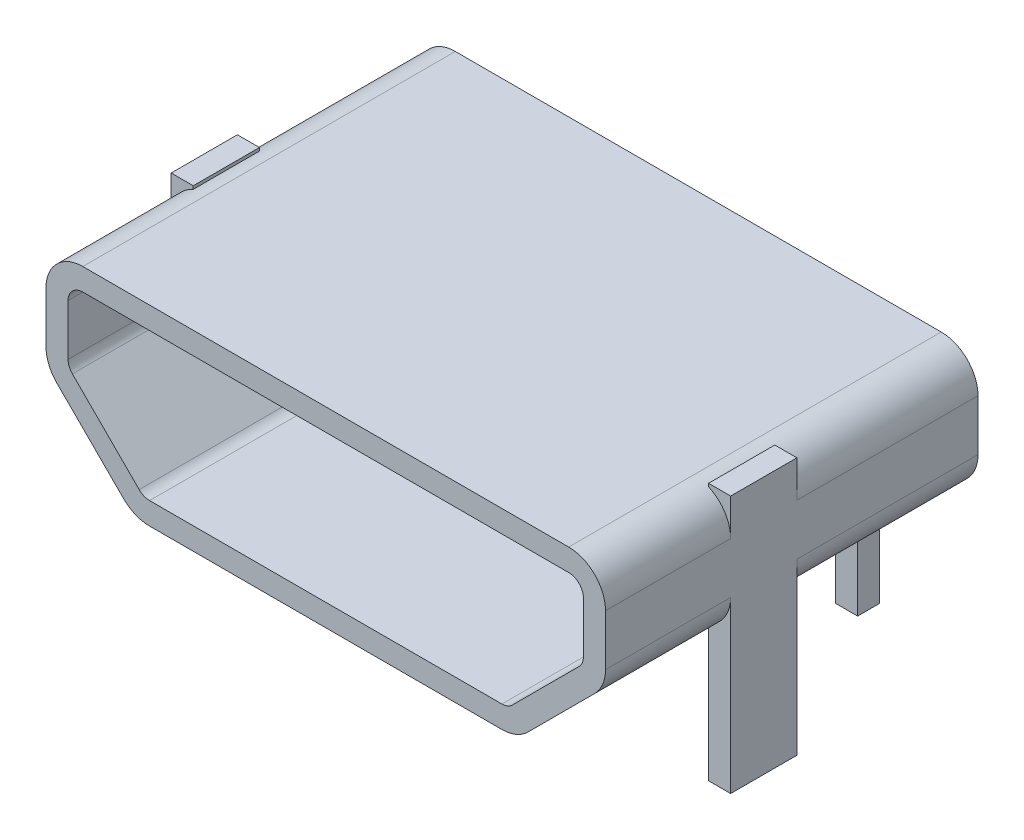
from build123d import *

# Parameters (mm, degrees)
EXTRUDE_1_DEPTH     = 5.06
CUT_EXTRUDE_1_REACH = 8.841
SKETCH_2_W          = 0.3
SKETCH_2_H          = 0.3
SKETCH_2_H_2        = 0.9
EXTRUDE_2_DEPTH     = 3.5


with BuildPart() as part:
    # 草图1 → 凸台-拉伸1 (new body)
    with BuildSketch(Plane.XY):
        with BuildLine():
            Line((-3.653553391, 1.053553391), (-2.746446609, 0.146446609))
            ThreePointArc((-2.746446609, 0.146446609), (-2.584234935, 0.038060234), (-2.392893219, 0))
            Line((-2.392893219, 0), (2.392893219, 0))
            ThreePointArc((2.392893219, 0), (2.584234935, 0.038060234), (2.746446609, 0.146446609))
            Line((2.746446609, 0.146446609), (3.653553391, 1.053553391))
            ThreePointArc((3.653553391, 1.053553391), (3.761939766, 1.215765065), (3.8, 1.407106781))
            Line((3.8, 1.407106781), (3.8, 2.1))
            ThreePointArc((3.8, 2.1), (3.653553391, 2.453553391), (3.3, 2.6))
            Line((3.3, 2.6), (-3.3, 2.6))
            ThreePointArc((-3.3, 2.6), (-3.653553391, 2.453553391), (-3.8, 2.1))
            Line((-3.8, 2.1), (-3.8, 1.407106781))
            ThreePointArc((-3.8, 1.407106781), (-3.761939766, 1.215765065), (-3.653553391, 1.053553391))
        make_face()
    extrude(amount=EXTRUDE_1_DEPTH)

    # 草图4 → 切除-拉伸1 (cut, up to next)
    with BuildSketch(Plane(origin=(0, 0, 0), x_dir=(-1, 0, 0), z_dir=(0, 0, -1)), mode=Mode.PRIVATE) as cut_extrude_1_sk1:
        with BuildLine():
            Line((-2.392893219, 0.3), (2.392893219, 0.3))
            ThreePointArc((2.392893219, 0.3), (2.469429905, 0.315224093), (2.534314575, 0.358578644))
            Line((2.534314575, 0.358578644), (3.441421356, 1.265685425))
            ThreePointArc((3.441421356, 1.265685425), (3.484775907, 1.330570095), (3.5, 1.407106781))
            Line((3.5, 1.407106781), (3.5, 2.1))
            ThreePointArc((3.5, 2.1), (3.441421356, 2.241421356), (3.3, 2.3))
            Line((3.3, 2.3), (-3.3, 2.3))
            ThreePointArc((-3.3, 2.3), (-3.441421356, 2.241421356), (-3.5, 2.1))
            Line((-3.5, 2.1), (-3.5, 1.407106781))
            ThreePointArc((-3.5, 1.407106781), (-3.484775907, 1.330570095), (-3.441421356, 1.265685425))
            Line((-3.441421356, 1.265685425), (-2.534314575, 0.358578644))
            ThreePointArc((-2.534314575, 0.358578644), (-2.469429905, 0.315224093), (-2.392893219, 0.3))
        make_face()
    cut_extrude_1_tool1 = extrude(cut_extrude_1_sk1.sketch, amount=-CUT_EXTRUDE_1_REACH, mode=Mode.PRIVATE) & part.part
    add(cut_extrude_1_tool1.solids().sort_by_distance((0, 1.352294, 0))[0], mode=Mode.SUBTRACT)

    # 草图2 → 凸台-拉伸2 (add)
    with BuildSketch(Plane(origin=(0, 2.6, 0), x_dir=(1, 0, 0), z_dir=(0, 1, 0))):
        with Locations((-2.425, -0.26)):
            Rectangle(SKETCH_2_W, SKETCH_2_H)
        with Locations((-3.65, -2.91)):
            Rectangle(SKETCH_2_W, SKETCH_2_H_2)
        with Locations((3.65, -2.91)):
            Rectangle(SKETCH_2_W, SKETCH_2_H_2)
        with Locations((2.425, -0.26)):
            Rectangle(SKETCH_2_W, SKETCH_2_H)
    extrude(amount=-EXTRUDE_2_DEPTH)


solid = part.part
